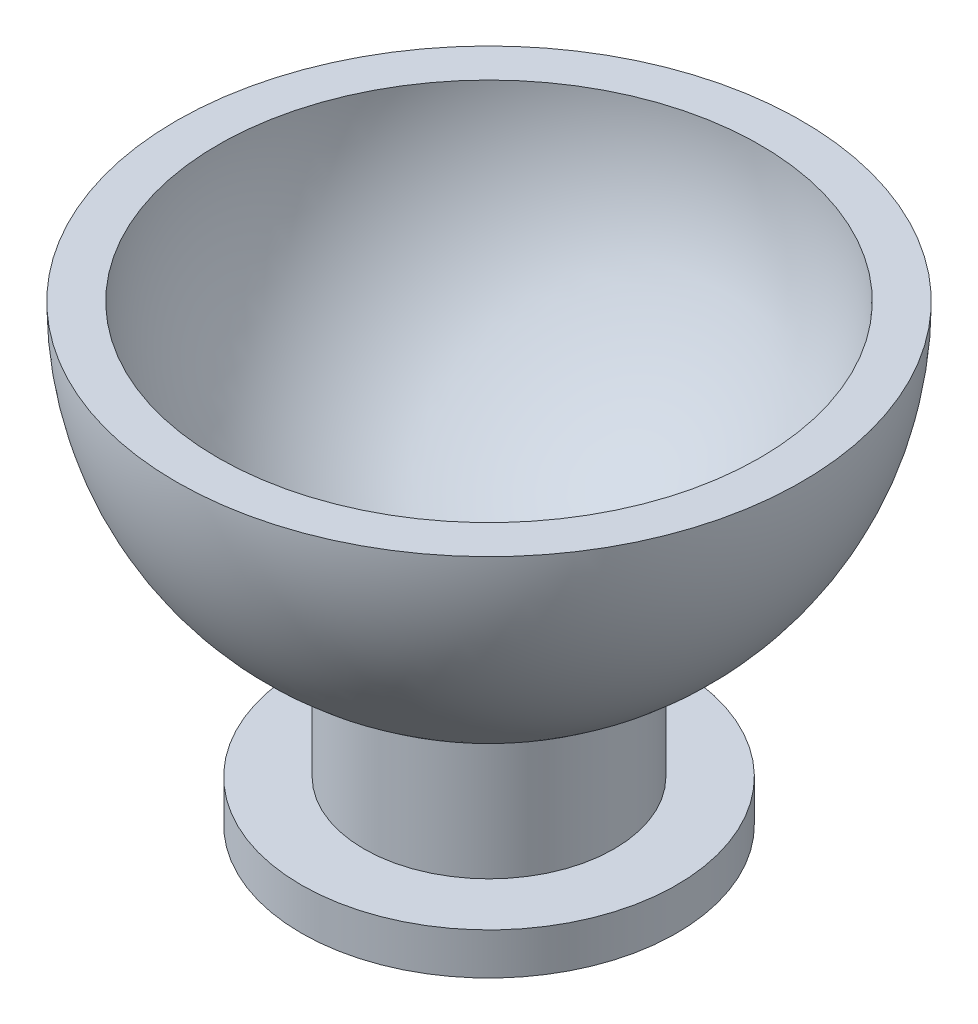
from build123d import *

# Parameters (mm, degrees)
SKETCH2_R           = 11.43
BOSS_EXTRUDE1_DEPTH = 2.54
SKETCH3_R           = 7.62
BOSS_EXTRUDE2_DEPTH = 7.62


with BuildPart() as part:
    # Sketch2 → Boss-Extrude1 (new body)
    with BuildSketch(Plane(origin=(0, 0, 0), x_dir=(1, 0, 0), z_dir=(0, 1, 0))):
        Circle(SKETCH2_R)
    extrude(amount=BOSS_EXTRUDE1_DEPTH)

    # Sketch3 → Boss-Extrude2 (add)
    with BuildSketch(Plane(origin=(0, 2.54, 0), x_dir=(1, 0, 0), z_dir=(0, 1, 0))):
        Circle(SKETCH3_R)
    extrude(amount=BOSS_EXTRUDE2_DEPTH)


with BuildPart() as body_2:
    # Sketch5 → Revolve1 (revolve)
    with BuildSketch(Plane.XY):
        with BuildLine():
            Line((16.51, 27.619613398), (19.05, 27.619613398))
            ThreePointArc((19.05, 27.619613398), (13.470384182, 14.149229216), (0, 8.569613398))
            Line((0, 8.569613398), (0, 11.109613398))
            ThreePointArc((0, 11.109613398), (11.674332957, 15.94528044), (16.51, 27.619613398))
        make_face()
    revolve(axis=Axis((0, 47.87511184, 0), (0, -1, 0)))


solid = Compound([part.part, body_2.part])
